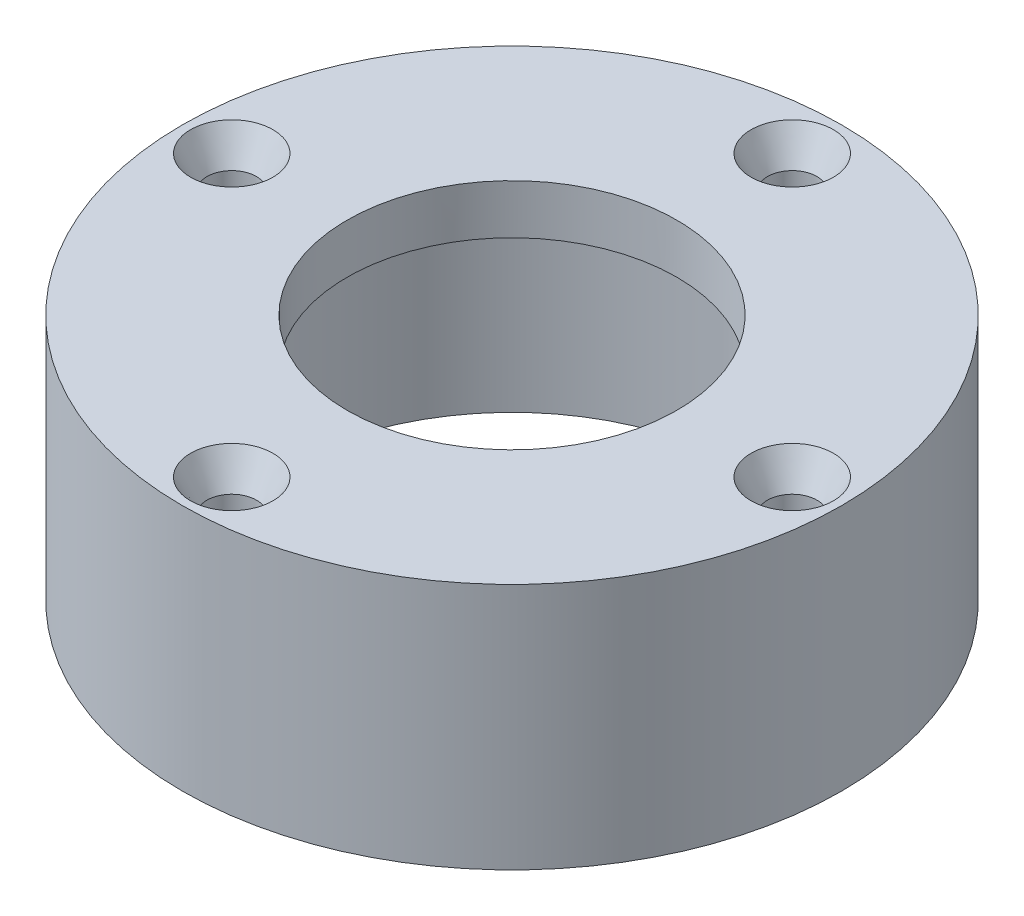
from build123d import *

# Parameters (mm, degrees)
SKETCH1_R                    = 20
BOSS_EXTRUDE1_DEPTH          = 15
SKETCH4_R                    = 14
CUT_EXTRUDE3_DEPTH           = 12
SKETCH5_R                    = 10
CUT_EXTRUDE4_DEPTH           = 12
SKETCH6_R                    = 1.5
CUT_EXTRUDE5_DEPTH           = 33.015621187
SKETCH7_R                    = 2.5
CUT_EXTRUDE7_DEPTH           = 2
CUT_EXTRUDE7_DRAFT           = -27
CUT_EXTRUDE7_PROFILE_2_DEPTH = 2
CUT_EXTRUDE7_PROFILE_2_DRAFT = -27
CUT_EXTRUDE7_PROFILE_3_DEPTH = 2
CUT_EXTRUDE7_PROFILE_3_DRAFT = -27
CUT_EXTRUDE7_PROFILE_4_DEPTH = 2
CUT_EXTRUDE7_PROFILE_4_DRAFT = -27


with BuildPart() as part:
    # Sketch1 → Boss-Extrude1 (new body)
    with BuildSketch(Plane(origin=(0, 0, 0), x_dir=(1, 0, 0), z_dir=(0, 1, 0))):
        Circle(SKETCH1_R)
    extrude(amount=BOSS_EXTRUDE1_DEPTH)

    # Sketch4 → Cut-Extrude3 (cut)
    with BuildSketch(Plane.XZ):
        Circle(SKETCH4_R)
    extrude(amount=-CUT_EXTRUDE3_DEPTH, mode=Mode.SUBTRACT)

    # Sketch5 → Cut-Extrude4 (cut)
    with BuildSketch(Plane(origin=(0, 15, 0), x_dir=(1, 0, 0), z_dir=(0, 1, 0))):
        Circle(SKETCH5_R)
    extrude(amount=-CUT_EXTRUDE4_DEPTH, mode=Mode.SUBTRACT)

    # Sketch6 → Cut-Extrude5 (cut, through all)
    with BuildSketch(Plane(origin=(0, 15, 0), x_dir=(1, 0, 0), z_dir=(0, 1, 0))):
        with Locations((0, 17)):
            Circle(SKETCH6_R)
        with Locations((17, 0)):
            Circle(SKETCH6_R)
        with Locations((0, -17)):
            Circle(SKETCH6_R)
        with Locations((-17, 0)):
            Circle(SKETCH6_R)
    extrude(amount=-CUT_EXTRUDE5_DEPTH, mode=Mode.SUBTRACT)


with BuildPart() as cut_extrude7_tool:
    # Sketch7 → Cut-Extrude7 (with draft: the straight prism first)
    with BuildSketch(Plane(origin=(0, 15, 0), x_dir=(1, 0, 0), z_dir=(0, 1, 0))):
        with Locations((0, 17)):
            Circle(SKETCH7_R)
    extrude(amount=-CUT_EXTRUDE7_DEPTH)
    # Cut-Extrude7: the draft: its side faces are tilted about the plane it starts from
    cut_extrude7_sides = [cut_extrude7_tool.faces().sort_by_distance(p)[0] for p in [
        (-2.5, 14, -17),
    ]]
    draft(cut_extrude7_sides, Plane(origin=(0, 15, 0), x_dir=(1, 0, 0), z_dir=(0, 1, 0)), CUT_EXTRUDE7_DRAFT)


with BuildPart() as part_1:
    add(part.part)

    # Cut-Extrude7: cut by cut_extrude7_tool
    add(cut_extrude7_tool.part, mode=Mode.SUBTRACT)


with BuildPart() as cut_extrude7_profile_2_tool:
    # Sketch7 → Cut-Extrude7 profile 2 (with draft: the straight prism first)
    with BuildSketch(Plane(origin=(0, 15, 0), x_dir=(1, 0, 0), z_dir=(0, 1, 0))):
        with Locations((17, 0)):
            Circle(SKETCH7_R)
    extrude(amount=-CUT_EXTRUDE7_PROFILE_2_DEPTH)
    # Cut-Extrude7 profile 2: the draft: its side faces are tilted about the plane it starts from
    cut_extrude7_profile_2_sides = [cut_extrude7_profile_2_tool.faces().sort_by_distance(p)[0] for p in [
        (14.5, 14, 0),
    ]]
    draft(cut_extrude7_profile_2_sides, Plane(origin=(0, 15, 0), x_dir=(1, 0, 0), z_dir=(0, 1, 0)), CUT_EXTRUDE7_PROFILE_2_DRAFT)


with BuildPart() as part_2:
    add(part_1.part)

    # Cut-Extrude7 profile 2: cut by cut_extrude7_profile_2_tool
    add(cut_extrude7_profile_2_tool.part, mode=Mode.SUBTRACT)


with BuildPart() as cut_extrude7_profile_3_tool:
    # Sketch7 → Cut-Extrude7 profile 3 (with draft: the straight prism first)
    with BuildSketch(Plane(origin=(0, 15, 0), x_dir=(1, 0, 0), z_dir=(0, 1, 0))):
        with Locations((0, -17)):
            Circle(SKETCH7_R)
    extrude(amount=-CUT_EXTRUDE7_PROFILE_3_DEPTH)
    # Cut-Extrude7 profile 3: the draft: its side faces are tilted about the plane it starts from
    cut_extrude7_profile_3_sides = [cut_extrude7_profile_3_tool.faces().sort_by_distance(p)[0] for p in [
        (-2.5, 14, 17),
    ]]
    draft(cut_extrude7_profile_3_sides, Plane(origin=(0, 15, 0), x_dir=(1, 0, 0), z_dir=(0, 1, 0)), CUT_EXTRUDE7_PROFILE_3_DRAFT)


with BuildPart() as part_3:
    add(part_2.part)

    # Cut-Extrude7 profile 3: cut by cut_extrude7_profile_3_tool
    add(cut_extrude7_profile_3_tool.part, mode=Mode.SUBTRACT)


with BuildPart() as cut_extrude7_profile_4_tool:
    # Sketch7 → Cut-Extrude7 profile 4 (with draft: the straight prism first)
    with BuildSketch(Plane(origin=(0, 15, 0), x_dir=(1, 0, 0), z_dir=(0, 1, 0))):
        with Locations((-17, 0)):
            Circle(SKETCH7_R)
    extrude(amount=-CUT_EXTRUDE7_PROFILE_4_DEPTH)
    # Cut-Extrude7 profile 4: the draft: its side faces are tilted about the plane it starts from
    cut_extrude7_profile_4_sides = [cut_extrude7_profile_4_tool.faces().sort_by_distance(p)[0] for p in [
        (-19.5, 14, 0),
    ]]
    draft(cut_extrude7_profile_4_sides, Plane(origin=(0, 15, 0), x_dir=(1, 0, 0), z_dir=(0, 1, 0)), CUT_EXTRUDE7_PROFILE_4_DRAFT)


with BuildPart() as part_4:
    add(part_3.part)

    # Cut-Extrude7 profile 4: cut by cut_extrude7_profile_4_tool
    add(cut_extrude7_profile_4_tool.part, mode=Mode.SUBTRACT)


solid = part_4.part
